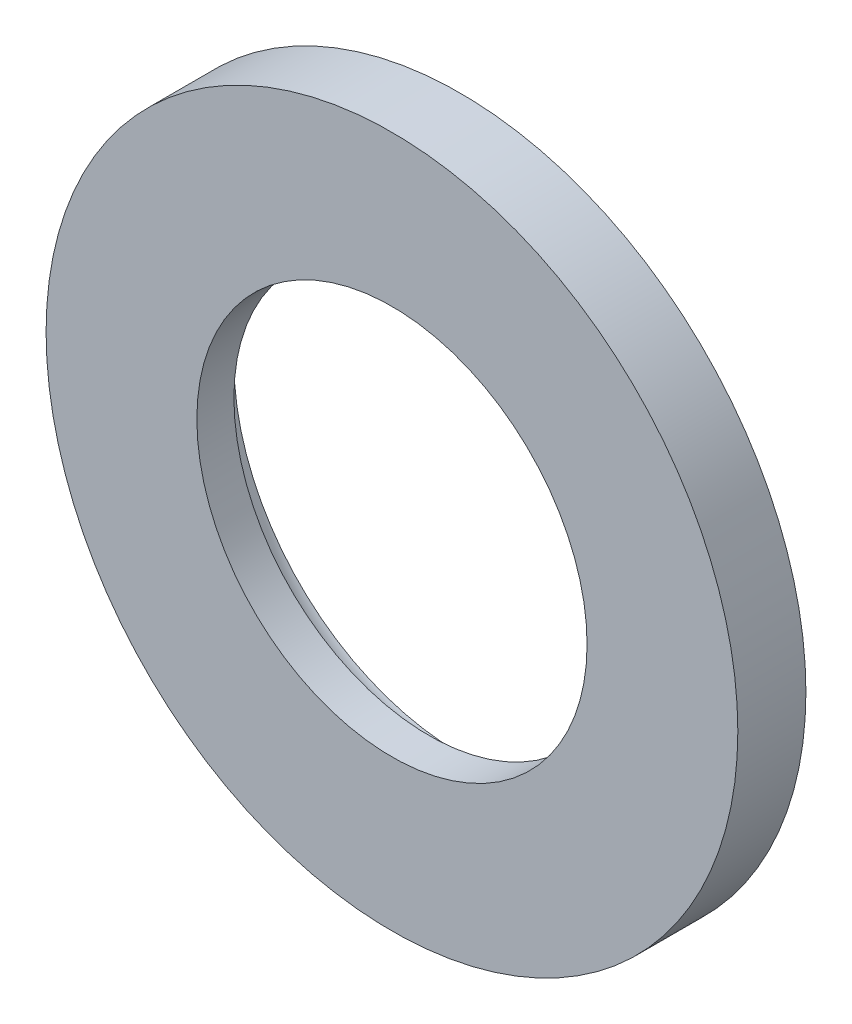
from build123d import *

# Parameters (mm, degrees)
SKETCH1_R                  = 9.906
BOSS_EXTRUDE1_DEPTH        = 1.95
F_97_0_44_DIAMETER_HOLE1_D = 11.176


# Read off the part's stored shape, not the designer's step: Cut-Sweep1
with BuildPart() as part:
    # Sketch1 → Boss-Extrude1 (new body)
    with BuildSketch(Plane.XY):
        Circle(SKETCH1_R)
    extrude(amount=-BOSS_EXTRUDE1_DEPTH)

    # #97 (0.44) Diameter Hole1 (through all)
    with Locations(Plane(origin=(0, 0, -1.95), x_dir=(-1, 0, 0), z_dir=(0, 0, -1))):
        with Locations((0, 0)):
            Hole(F_97_0_44_DIAMETER_HOLE1_D / 2)

    # Cut-Sweep1 outline → Cut-Sweep1 (revolve, cut)
    with BuildSketch(Plane.XZ):
        with BuildLine():
            ThreePointArc((6.477, -1.95), (6.216617928, -1.321382072), (5.588, -1.061))
            Line((5.588, -1.061), (5.588, -1.95))
            Line((5.588, -1.95), (6.477, -1.95))
        make_face()
    revolve(axis=Axis((0, 0, 0), (0, 0, 1)), mode=Mode.SUBTRACT)


solid = part.part
